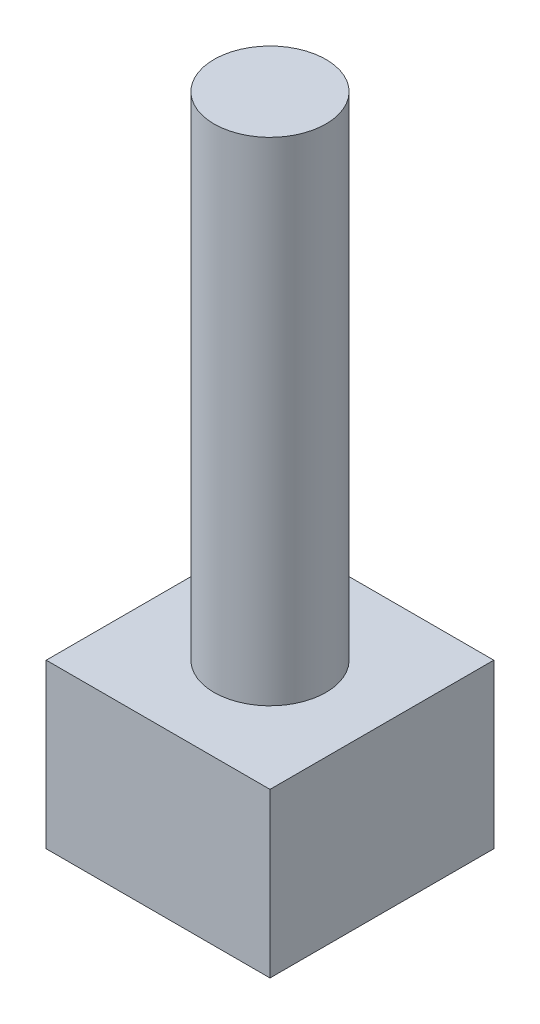
from build123d import *

# Parameters (mm, degrees)
SKETCH1_R           = 6.35
BOSS_EXTRUDE1_DEPTH = 55.88
SKETCH2_W           = 25.4
SKETCH2_H           = 25.4
BOSS_EXTRUDE2_DEPTH = 18.542


with BuildPart() as part:
    # Sketch1 → Boss-Extrude1 (new body)
    with BuildSketch(Plane(origin=(0, 0, 0), x_dir=(1, 0, 0), z_dir=(0, 1, 0))):
        Circle(SKETCH1_R)
    extrude(amount=BOSS_EXTRUDE1_DEPTH)

    # Sketch2 → Boss-Extrude2 (add)
    with BuildSketch(Plane.XZ):
        Rectangle(SKETCH2_W, SKETCH2_H)
    extrude(amount=BOSS_EXTRUDE2_DEPTH)


solid = part.part
